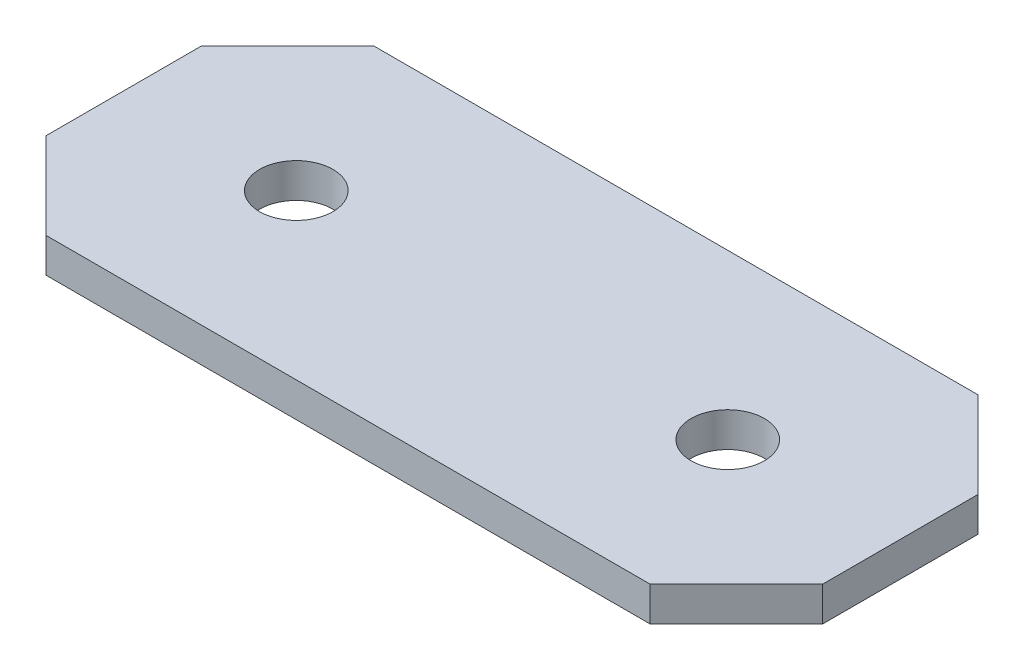
from build123d import *

# Parameters (mm, degrees)
SZKIC1_R                    = 4.25
DODANIE_WYCI_GNI_CIE1_DEPTH = 4


with BuildPart() as part:
    # Szkic1 → Dodanie-wyciągnięcie1 (new body)
    with BuildSketch(Plane(origin=(0, 0, 0), x_dir=(1, 0, 0), z_dir=(0, 1, 0))):
        Polygon((45, -9), (45, 9), (35, 19), (-35, 19), (-45, 9), (-45, -9), (-35, -19), (35, -19), align=None)
        with Locations((25, 0)):
            Circle(SZKIC1_R, mode=Mode.SUBTRACT)
        with Locations((-25, 0)):
            Circle(SZKIC1_R, mode=Mode.SUBTRACT)
    extrude(amount=DODANIE_WYCI_GNI_CIE1_DEPTH)


solid = part.part
